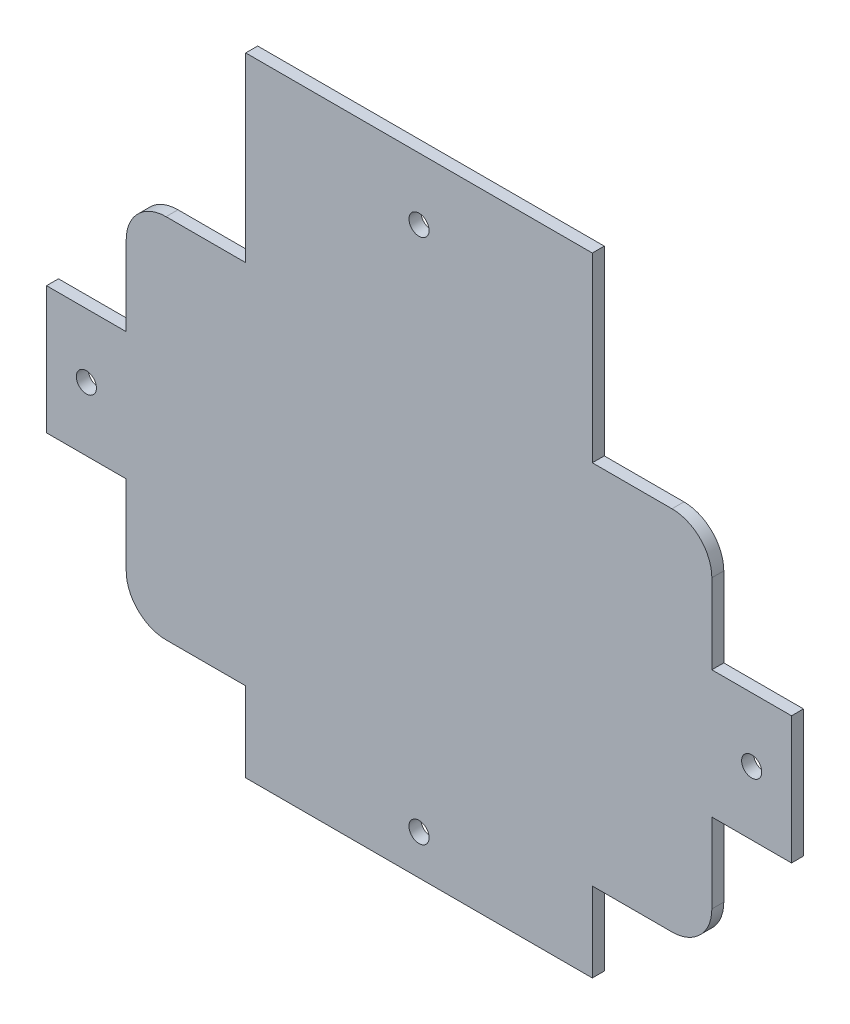
from build123d import *

# Parameters (mm, degrees)
SKETCH1_R           = 2.525
BOSS_EXTRUDE1_DEPTH = 3


with BuildPart() as part:
    # Sketch1 → Boss-Extrude1 (new body)
    with BuildSketch(Plane.XY):
        with BuildLine():
            Line((-48.888270171, 93.388121638), (-48.888270171, 47.788121638))
            Line((-48.888270171, 47.788121638), (-68.888270171, 47.788121638))
            ThreePointArc((-68.888270171, 47.788121638), (-75.959337983, 44.85918945), (-78.888270171, 37.788121638))
            Line((-78.888270171, 37.788121638), (-78.888270171, 17.788121638))
            Line((-78.888270171, 17.788121638), (-98.888270171, 17.788121638))
            Line((-98.888270171, 17.788121638), (-98.888270171, -14.211878362))
            Line((-98.888270171, -14.211878362), (-78.888270171, -14.211878362))
            Line((-78.888270171, -14.211878362), (-78.888270171, -34.211878362))
            ThreePointArc((-78.888270171, -34.211878362), (-75.959337983, -41.282946174), (-68.888270171, -44.211878362))
            Line((-68.888270171, -44.211878362), (-48.888270171, -44.211878362))
            Line((-48.888270171, -44.211878362), (-48.888270171, -64.211878362))
            Line((-48.888270171, -64.211878362), (38.111729829, -64.211878362))
            Line((38.111729829, -64.211878362), (38.111729829, -44.211878362))
            Line((38.111729829, -44.211878362), (58.111729829, -44.211878362))
            ThreePointArc((58.111729829, -44.211878362), (65.182797641, -41.282946174), (68.111729829, -34.211878362))
            Line((68.111729829, -34.211878362), (68.111729829, -14.211878362))
            Line((68.111729829, -14.211878362), (88.111729829, -14.211878362))
            Line((88.111729829, -14.211878362), (88.111729829, 17.788121638))
            Line((88.111729829, 17.788121638), (68.111729829, 17.788121638))
            Line((68.111729829, 17.788121638), (68.111729829, 37.788121638))
            ThreePointArc((68.111729829, 37.788121638), (65.182797641, 44.85918945), (58.111729829, 47.788121638))
            Line((58.111729829, 47.788121638), (38.111729829, 47.788121638))
            Line((38.111729829, 47.788121638), (38.111729829, 93.388121638))
            Line((38.111729829, 93.388121638), (-48.888270171, 93.388121638))
        make_face()
        with Locations((-5.388270171, 77.788121638)):
            Circle(SKETCH1_R, mode=Mode.SUBTRACT)
        with Locations((-88.888270171, 1.788121638)):
            Circle(SKETCH1_R, mode=Mode.SUBTRACT)
        with Locations((78.111729829, 1.788121638)):
            Circle(SKETCH1_R, mode=Mode.SUBTRACT)
        with Locations((-5.388270171, -54.211878362)):
            Circle(SKETCH1_R, mode=Mode.SUBTRACT)
    extrude(amount=BOSS_EXTRUDE1_DEPTH)


solid = part.part
